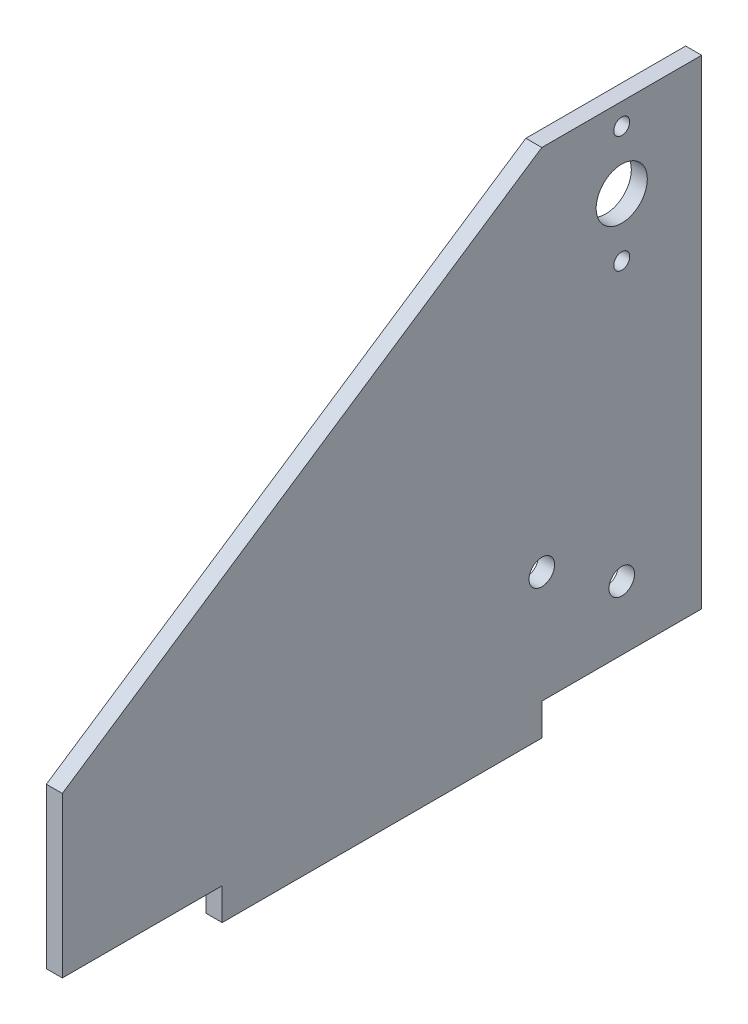
from build123d import *

# Parameters (mm, degrees)
CROQUIS1_R              = 8
CROQUIS1_R_2            = 4
CROQUIS1_R_3            = 2.5
SALIENTE_EXTRUIR1_DEPTH = 5


with BuildPart() as part:
    # Croquis1 → Saliente-Extruir1 (new body)
    with BuildSketch(Plane(origin=(0, 0, 0), x_dir=(0, 0, -1), z_dir=(1, 0, 0))):
        Polygon((50, 75), (-100, -25), (-100, -75), (-50, -75), (-50, -85), (50, -85), (50, -75), (100, -75), (100, 75), align=None)
        with Locations((75, 50)):
            Circle(CROQUIS1_R, mode=Mode.SUBTRACT)
        with Locations((75, -55)):
            Circle(CROQUIS1_R_2, mode=Mode.SUBTRACT)
        with Locations((50, -40)):
            Circle(CROQUIS1_R_2, mode=Mode.SUBTRACT)
        with Locations((75, 68.25)):
            Circle(CROQUIS1_R_3, mode=Mode.SUBTRACT)
        with Locations((75, 31.75)):
            Circle(CROQUIS1_R_3, mode=Mode.SUBTRACT)
    extrude(amount=SALIENTE_EXTRUIR1_DEPTH)


solid = part.part
